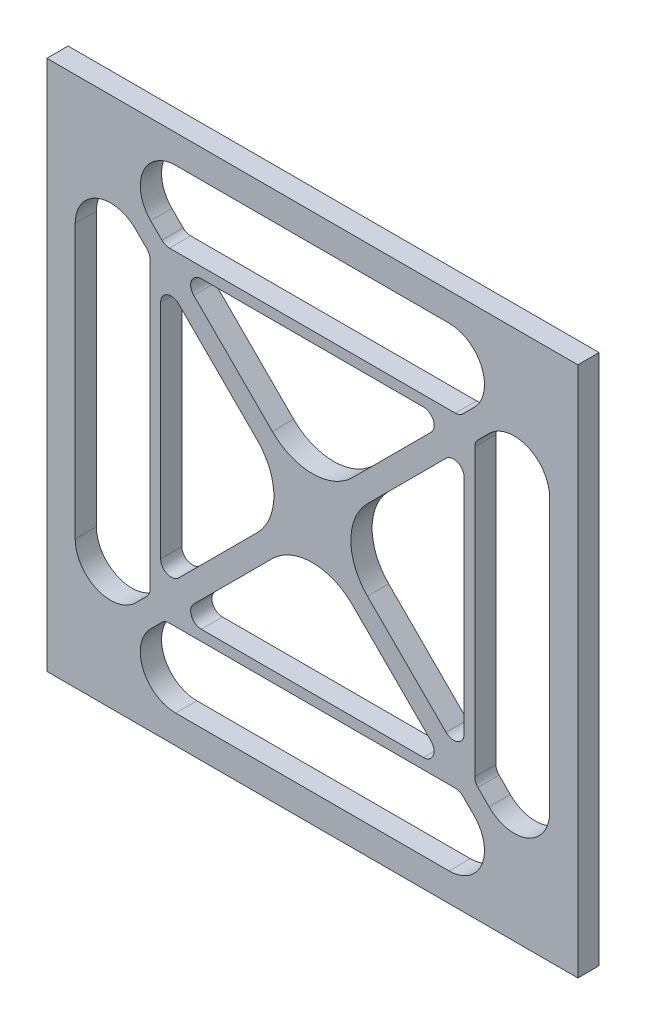
from build123d import *

# Parameters (mm, degrees)
SKETCH1_W           = 150
SKETCH1_H           = 150
BOSS_EXTRUDE1_DEPTH = 6
FILLET1_R           = 3


with BuildPart() as part:
    # Sketch1 → Boss-Extrude1 (new body)
    with BuildSketch(Plane.XY):
        Rectangle(SKETCH1_W, SKETCH1_H)
        with BuildLine():
            Line((38.615223689, -67), (-38.615223689, -67))
            ThreePointArc((-38.615223689, -67), (-47.854019014, -60.826834324), (-45.686291501, -49.928932188))
            Line((-45.686291501, -49.928932188), (-41.627416998, -45.870057685))
            Line((-41.627416998, -45.870057685), (41.627416998, -45.870057685))
            Line((41.627416998, -45.870057685), (45.686291501, -49.928932188))
            ThreePointArc((45.686291501, -49.928932188), (47.854019014, -60.826834324), (38.615223689, -67))
        make_face(mode=Mode.SUBTRACT)
        with BuildLine():
            Line((11.313708499, -15.556349186), (38.627416998, -42.870057685))
            Line((38.627416998, -42.870057685), (-38.627416998, -42.870057685))
            Line((-38.627416998, -42.870057685), (-11.313708499, -15.556349186))
            ThreePointArc((-11.313708499, -15.556349186), (0, -10.870057685), (11.313708499, -15.556349186))
        make_face(mode=Mode.SUBTRACT)
        with BuildLine():
            Line((-67, -38.615223689), (-67, 38.615223689))
            ThreePointArc((-67, 38.615223689), (-60.826834324, 47.854019014), (-49.928932188, 45.686291501))
            Line((-49.928932188, 45.686291501), (-45.870057685, 41.627416998))
            Line((-45.870057685, 41.627416998), (-45.870057685, -41.627416998))
            Line((-45.870057685, -41.627416998), (-49.928932188, -45.686291501))
            ThreePointArc((-49.928932188, -45.686291501), (-60.826834324, -47.854019014), (-67, -38.615223689))
        make_face(mode=Mode.SUBTRACT)
        with BuildLine():
            Line((-15.556349186, -11.313708499), (-42.870057685, -38.627416998))
            Line((-42.870057685, -38.627416998), (-42.870057685, 38.627416998))
            Line((-42.870057685, 38.627416998), (-15.556349186, 11.313708499))
            ThreePointArc((-15.556349186, 11.313708499), (-10.870057685, 0), (-15.556349186, -11.313708499))
        make_face(mode=Mode.SUBTRACT)
        with BuildLine():
            ThreePointArc((49.928932188, 45.686291501), (60.826834324, 47.854019014), (67, 38.615223689))
            Line((67, 38.615223689), (67, -38.615223689))
            ThreePointArc((67, -38.615223689), (60.826834324, -47.854019014), (49.928932188, -45.686291501))
            Line((49.928932188, -45.686291501), (45.870057685, -41.627416998))
            Line((45.870057685, -41.627416998), (45.870057685, 41.627416998))
            Line((45.870057685, 41.627416998), (49.928932188, 45.686291501))
        make_face(mode=Mode.SUBTRACT)
        with BuildLine():
            Line((15.556349186, 11.313708499), (42.870057685, 38.627416998))
            Line((42.870057685, 38.627416998), (42.870057685, -38.627416998))
            Line((42.870057685, -38.627416998), (15.556349186, -11.313708499))
            ThreePointArc((15.556349186, -11.313708499), (10.870057685, 0), (15.556349186, 11.313708499))
        make_face(mode=Mode.SUBTRACT)
        with BuildLine():
            Line((-41.627416998, 45.870057685), (-45.686291501, 49.928932188))
            ThreePointArc((-45.686291501, 49.928932188), (-47.854019014, 60.826834324), (-38.615223689, 67))
            Line((-38.615223689, 67), (38.615223689, 67))
            ThreePointArc((38.615223689, 67), (47.854019014, 60.826834324), (45.686291501, 49.928932188))
            Line((45.686291501, 49.928932188), (41.627416998, 45.870057685))
            Line((41.627416998, 45.870057685), (-41.627416998, 45.870057685))
        make_face(mode=Mode.SUBTRACT)
        with BuildLine():
            Line((-11.313708499, 15.556349186), (-38.627416998, 42.870057685))
            Line((-38.627416998, 42.870057685), (38.627416998, 42.870057685))
            Line((38.627416998, 42.870057685), (11.313708499, 15.556349186))
            ThreePointArc((11.313708499, 15.556349186), (0, 10.870057685), (-11.313708499, 15.556349186))
        make_face(mode=Mode.SUBTRACT)
    extrude(amount=BOSS_EXTRUDE1_DEPTH)

    # Fillet1
    fillet1_edges = [part.edges().sort_by_distance(p)[0] for p in [
        (-42.870057685, 38.627416998, 3),
        (-42.870057685, -38.627416998, 3),
        (-38.627416998, -42.870057685, 3),
        (38.627416998, -42.870057685, 3),
        (42.870057685, -38.627416998, 3),
        (38.627416998, 42.870057685, 3),
        (-38.627416998, 42.870057685, 3),
        (-45.870057685, 41.627416998, 3),
        (-45.870057685, -41.627416998, 3),
        (-41.627416998, -45.870057685, 3),
        (41.627416998, -45.870057685, 3),
        (45.870057685, -41.627416998, 3),
        (45.870057685, 41.627416998, 3),
        (41.627416998, 45.870057685, 3),
        (-41.627416998, 45.870057685, 3),
        (42.870057685, 38.627416998, 3),
    ]]
    fillet(fillet1_edges, radius=FILLET1_R)


solid = part.part
